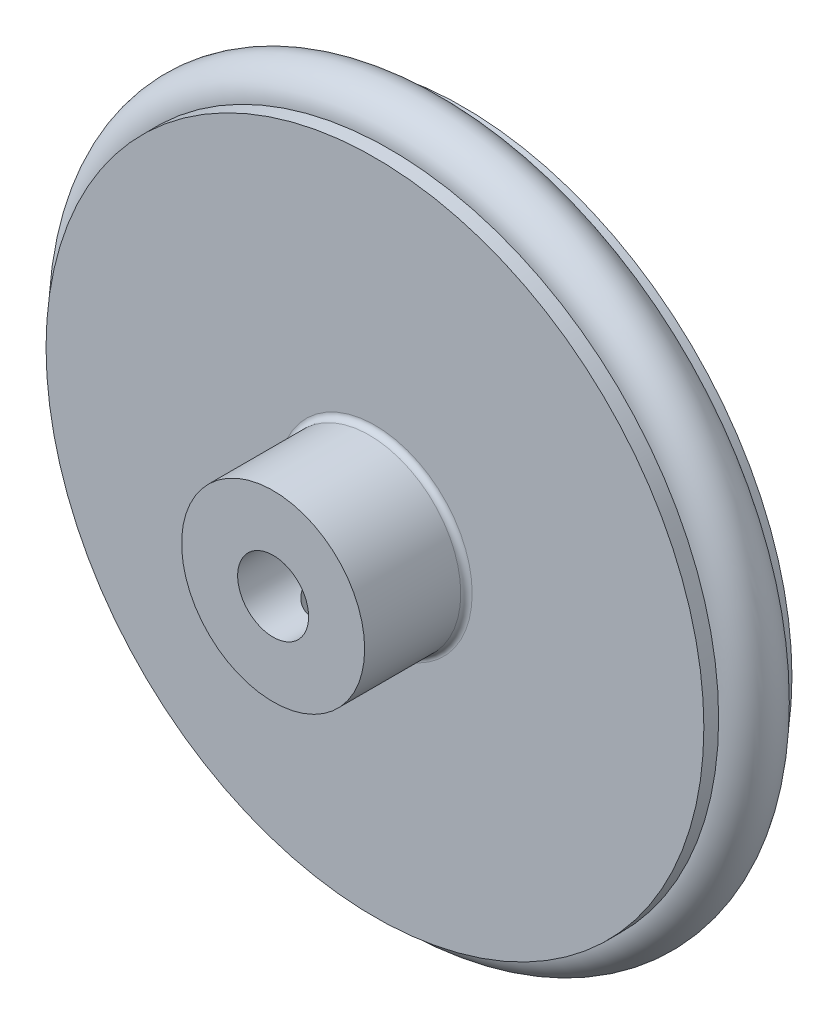
from build123d import *

# Parameters (mm, degrees)
SKETCH1_R           = 28.75
BOSS_EXTRUDE1_DEPTH = 3.85
SKETCH2_R           = 2.55
SWEEP1_OUTLINE_R    = 2.561236926
SKETCH4_R           = 8
BOSS_EXTRUDE2_DEPTH = 8.9
SKETCH5_R           = 3.1
CUT_EXTRUDE1_DEPTH  = 15.6
SKETCH6_R           = 2
CUT_EXTRUDE2_DEPTH  = 47.079818014
FILLET1_R           = 0.5


# Read off the part's stored shape, not the designer's step: Sweep1
with BuildPart() as part:
    # Sketch1 → Boss-Extrude1 (new, symmetric)
    with BuildSketch(Plane.XY):
        with Locations(Location((0, 0, 0), (0, 0, 180))):
            Circle(SKETCH1_R)
    extrude(amount=BOSS_EXTRUDE1_DEPTH, both=True)

    # Cut-Sweep1: sweep along a curve in space
    with BuildLine() as cut_sweep1_path:
        ThreePointArc((28.75, 0, -3.85), (20.329319959, 20.329319959, -3.85), (0, 28.75, -3.85))
        ThreePointArc((0, 28.75, -3.85), (-20.329319959, 20.329319959, -3.85), (-28.75, 0, -3.85))
        ThreePointArc((-28.75, 0, -3.85), (-20.329319959, -20.329319959, -3.85), (0, -28.75, -3.85))
        ThreePointArc((0, -28.75, -3.85), (20.329319959, -20.329319959, -3.85), (28.75, 0, -3.85))
    # Sketch2 → Cut-Sweep1 (sweep, cut)
    with BuildSketch(Plane(origin=(0, 0, 0), x_dir=(1, 0, 0), z_dir=(0, 1, 0))):
        with Locations((28.75, 0)):
            Circle(SKETCH2_R)
    sweep(path=cut_sweep1_path.line, mode=Mode.SUBTRACT)

    # Sketch4 → Boss-Extrude2 (add)
    with BuildSketch(Plane.XY.offset(3.85)):
        Circle(SKETCH4_R)
    extrude(amount=BOSS_EXTRUDE2_DEPTH)

    # Sketch5 → Cut-Extrude1 (cut)
    with BuildSketch(Plane.XY.offset(12.75)):
        Circle(SKETCH5_R)
    extrude(amount=-CUT_EXTRUDE1_DEPTH, mode=Mode.SUBTRACT)

    # Sketch6 → Cut-Extrude2 (cut, through all)
    with BuildSketch(Plane(origin=(0, 0, 0), x_dir=(1, 0, 0), z_dir=(0, 1, 0))):
        with Locations(Location((0, -7.5, 0), (0, 0, 270))):
            Circle(SKETCH6_R)
    extrude(amount=-CUT_EXTRUDE2_DEPTH, mode=Mode.SUBTRACT)

    # Fillet1
    fillet1_edges = [part.edges().sort_by_distance(p)[0] for p in [
        (-8, 0, 3.85),
    ]]
    fillet(fillet1_edges, radius=FILLET1_R)


with BuildPart() as body_2:
    # Sweep1 outline → Sweep1 (revolve)
    with BuildSketch(Plane.XZ):
        with Locations((28.75, 0)):
            Circle(SWEEP1_OUTLINE_R)
    revolve(axis=Axis((0, 0, 0), (0, 0, 1)))


solid = Compound([part.part, body_2.part])
